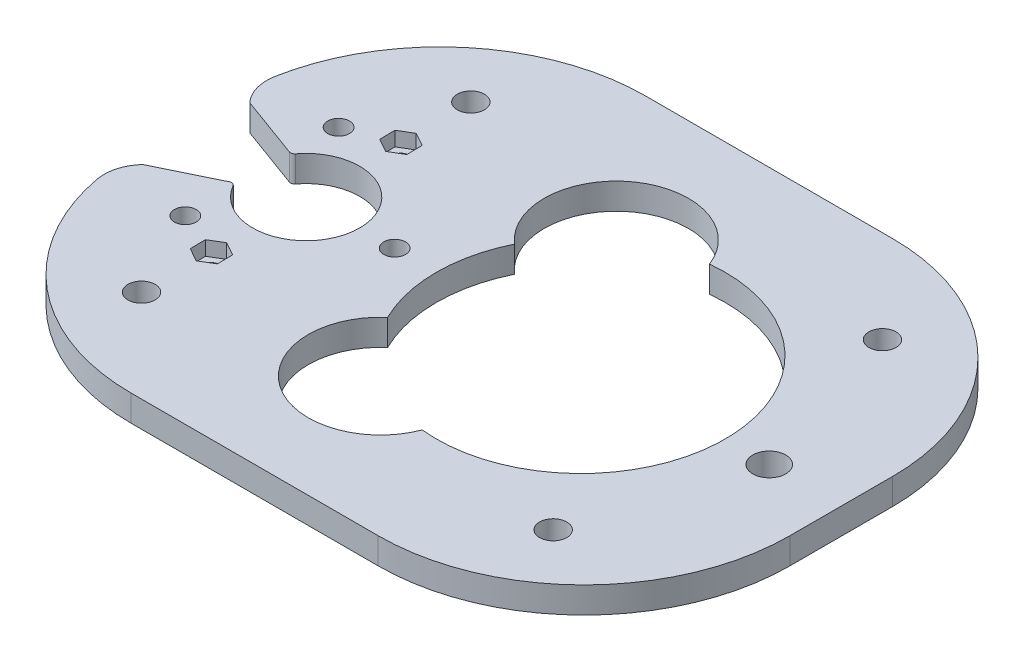
from build123d import *

# Parameters (mm, degrees)
SKETCH2_R                = 13
SKETCH2_R_2              = 4
BOSS_EXTRUDE1_DEPTH      = 6.35
FILLET1_R                = 50
M6_CLEARANCE_HOLE1_D     = 6.6
M6_CLEARANCE_HOLE1_DEPTH = 15
M6_CLEARANCE_HOLE1_TIP   = 1.982840043
FILLET2_R                = 10
CUT_EXTRUDE1_REACH       = 103.718
SKETCH5_R                = 2.65
SKETCH5_R_2              = 1.75
CUT_EXTRUDE2_DEPTH       = 3.5
CUT_EXTRUDE3_REACH       = 103.718
FILLET3_R                = 1
CUT_EXTRUDE4_REACH       = 103.718


with BuildPart() as part:
    # Sketch2 → Boss-Extrude1 (new body)
    with BuildSketch(Plane(origin=(0, 0, 0), x_dir=(1, 0, 0), z_dir=(0, 1, 0))):
        with BuildLine():
            ThreePointArc((-76.703745056, 13), (-79.7, 0), (-76.703745056, -13))
            Line((-76.703745056, -13), (-80, -13))
            Line((-80, -13), (-80, -62.5))
            Line((-80, -62.5), (80, -62.5))
            Line((80, -62.5), (80, 62.5))
            Line((80, 62.5), (-80, 62.5))
            Line((-80, 62.5), (-80, 13))
            Line((-80, 13), (-76.703745056, 13))
        make_face()
        with Locations(Location((-50, 0, 0), (0, 0, 270))):
            Circle(SKETCH2_R, mode=Mode.SUBTRACT)
        with Locations(Location((62.5, 0, 0), (0, 0, 270))):
            Circle(SKETCH2_R_2, mode=Mode.SUBTRACT)
    extrude(amount=BOSS_EXTRUDE1_DEPTH)

    # Fillet1
    # the kernel refuses this fillet: 50 mm, written as the material it takes off along each edge
    with BuildSketch(Plane(origin=(80, -125, 62.5), x_dir=(-1, 0, 0), z_dir=(0, 1, 0)), Plane(origin=(80, -125, -62.5), x_dir=(0, 0, 1), z_dir=(0, 1, 0))) as fillet1_piece_1:
        with BuildLine():
            CenterArc((FILLET1_R, -FILLET1_R), FILLET1_R, 90, 90)
            Line((0, -FILLET1_R), (-FILLET1_R * 0.02, -FILLET1_R))
            Line((-FILLET1_R * 0.02, -FILLET1_R), (-FILLET1_R * 0.02, FILLET1_R * 0.02))
            Line((-FILLET1_R * 0.02, FILLET1_R * 0.02), (FILLET1_R, FILLET1_R * 0.02))
            Line((FILLET1_R, FILLET1_R * 0.02), (FILLET1_R, 0))
        make_face()
    extrude(amount=256.35, mode=Mode.SUBTRACT)
    with BuildSketch(Plane(origin=(-80, -124.993749844, -62.5), x_dir=(1, 0, 0), z_dir=(0, 1, 0))) as fillet1_piece_2:
        with BuildLine():
            CenterArc((49.997499938, -50), FILLET1_R, 90, 89.427032655)
            Line((0, -49.5), (-0.999949999, -49.49))
            ThreePointArc((-0.999949999, -49.49), (-1, -24.75), (-1, 0))
            Line((-1, 0), (0, 1))
            Line((0, 1), (49.997499938, 1))
            Line((49.997499938, 1), (49.997499938, 0))
        make_face()
    extrude(amount=256.337499688, mode=Mode.SUBTRACT)
    with BuildSketch(Plane(origin=(-80, -124.993749844, 62.5), x_dir=(0, 0, -1), z_dir=(0, 1, 0))) as fillet1_piece_3:
        with BuildLine():
            CenterArc((50, -49.997499937), FILLET1_R, 90.572967345, 89.427032655)
            Line((0, -49.997499938), (-1, -49.997499938))
            Line((-1, -49.997499938), (-1, 0))
            Line((-1, 0), (0, 1))
            ThreePointArc((0, 1), (24.75, 1), (49.49, 0.999949999))
            Line((49.49, 0.999949999), (49.5, 0))
        make_face()
    extrude(amount=256.337499688, mode=Mode.SUBTRACT)

    # M6 Clearance Hole1
    with Locations(Plane(origin=(0, 6.35, 0), x_dir=(1, 0, 0), z_dir=(0, 1, 0))):
        with Locations((50, 40), (-50, -40), (-50, 40), (50, -40)):
            Hole(M6_CLEARANCE_HOLE1_D / 2, depth=M6_CLEARANCE_HOLE1_DEPTH)
            with Locations((0, 0, -(M6_CLEARANCE_HOLE1_DEPTH + M6_CLEARANCE_HOLE1_TIP / 2))):  # 118° drill point
                Cone(0, M6_CLEARANCE_HOLE1_D / 2, M6_CLEARANCE_HOLE1_TIP, mode=Mode.SUBTRACT)

    # Fillet2
    # the kernel refuses this fillet: 10 mm, written as the material it takes off along each edge
    with BuildSketch(Plane(origin=(-80, -21.546986926, 13), x_dir=(1, 0, 0), z_dir=(0, 1, 0))) as fillet2_piece_1:
        with BuildLine():
            CenterArc((10.662433046, -6.7630925), FILLET2_R, 137.444096304, 53.017550986)
            Line((0.828666324, -8.578865625), (0.631990989, -8.615181088))
            ThreePointArc((0.631990989, -8.615181088), (0.030066454, -4.326550643), (-0.19999, -0.002))
            Line((-0.19999, -0.002), (0, 0.2))
            ThreePointArc((0, 0.2), (1.648127472, 0.2), (3.148931382, 0.13526185))
            Line((3.148931382, 0.13526185), (3.296254944, 0))
        make_face()
    extrude(amount=49.443973852, mode=Mode.SUBTRACT)
    with BuildSketch(Plane(origin=(-80, -21.546986926, -13), x_dir=(1, 0, 0), z_dir=(0, 1, 0))) as fillet2_piece_2:
        with BuildLine():
            CenterArc((10.662433046, 6.7630925), FILLET2_R, 169.538352709, 53.017550986)
            Line((0.828666324, 8.578865625), (0.631990989, 8.615181088))
            ThreePointArc((0.631990989, 8.615181088), (0.030066454, 4.326550643), (-0.19999, 0.002))
            Line((-0.19999, 0.002), (0, -0.2))
            ThreePointArc((0, -0.2), (1.648127472, -0.2), (3.148931382, -0.13526185))
            Line((3.148931382, -0.13526185), (3.296254944, 0))
        make_face()
    extrude(amount=49.443973852, mode=Mode.SUBTRACT)

    # Sketch5 → Cut-Extrude1 (cut, up to next)
    with BuildSketch(Plane(origin=(0, 6.35, 0), x_dir=(1, 0, 0), z_dir=(0, 1, 0)), mode=Mode.PRIVATE) as cut_extrude1_sk1:
        with Locations(Location((-28.5, 0, 0), (0, 0, 270))):
            Circle(SKETCH5_R)
    cut_extrude1_tool1 = extrude(cut_extrude1_sk1.sketch, amount=-CUT_EXTRUDE1_REACH, mode=Mode.PRIVATE) & part.part
    # Sketch5 → Cut-Extrude1 (cut, up to next)
    with BuildSketch(Plane(origin=(0, 6.35, 0), x_dir=(1, 0, 0), z_dir=(0, 1, 0)), mode=Mode.PRIVATE) as cut_extrude1_sk2:
        with Locations(Location((-60.75, -18.619546181, 0), (0, 0, 270))):
            Circle(SKETCH5_R)
    cut_extrude1_tool2 = extrude(cut_extrude1_sk2.sketch, amount=-CUT_EXTRUDE1_REACH, mode=Mode.PRIVATE) & part.part
    # Sketch5 → Cut-Extrude1 (cut, up to next)
    with BuildSketch(Plane(origin=(0, 6.35, 0), x_dir=(1, 0, 0), z_dir=(0, 1, 0)), mode=Mode.PRIVATE) as cut_extrude1_sk3:
        with Locations(Location((-60.75, 18.619546181, 0), (0, 0, 270))):
            Circle(SKETCH5_R)
    cut_extrude1_tool3 = extrude(cut_extrude1_sk3.sketch, amount=-CUT_EXTRUDE1_REACH, mode=Mode.PRIVATE) & part.part
    # Sketch5 → Cut-Extrude1 (cut, up to next)
    with BuildSketch(Plane(origin=(0, 6.35, 0), x_dir=(1, 0, 0), z_dir=(0, 1, 0)), mode=Mode.PRIVATE) as cut_extrude1_sk4:
        with Locations(Location((-50, 23.015, 0), (0, 0, 270))):
            Circle(SKETCH5_R_2)
    cut_extrude1_tool4 = extrude(cut_extrude1_sk4.sketch, amount=-CUT_EXTRUDE1_REACH, mode=Mode.PRIVATE) & part.part
    # Sketch5 → Cut-Extrude1 (cut, up to next)
    with BuildSketch(Plane(origin=(0, 6.35, 0), x_dir=(1, 0, 0), z_dir=(0, 1, 0)), mode=Mode.PRIVATE) as cut_extrude1_sk5:
        with Locations(Location((-50, -23.015, 0), (0, 0, 270))):
            Circle(SKETCH5_R_2)
    cut_extrude1_tool5 = extrude(cut_extrude1_sk5.sketch, amount=-CUT_EXTRUDE1_REACH, mode=Mode.PRIVATE) & part.part
    add(cut_extrude1_tool1.solids().sort_by_distance((-28.5, 6.35, 0))[0], mode=Mode.SUBTRACT)
    add(cut_extrude1_tool2.solids().sort_by_distance((-60.75, 6.35, 18.619546))[0], mode=Mode.SUBTRACT)
    add(cut_extrude1_tool3.solids().sort_by_distance((-60.75, 6.35, -18.619546))[0], mode=Mode.SUBTRACT)
    add(cut_extrude1_tool4.solids().sort_by_distance((-50, 6.35, -23.015))[0], mode=Mode.SUBTRACT)
    add(cut_extrude1_tool5.solids().sort_by_distance((-50, 6.35, 23.015))[0], mode=Mode.SUBTRACT)

    # Sketch6 → Cut-Extrude2 (cut)
    with BuildSketch(Plane(origin=(0, 6.35, 0), x_dir=(1, 0, 0), z_dir=(0, 1, 0))):
        Polygon((-53.220697552, -24.941250403), (-49.942166993, -26.767331099), (-46.721469441, -24.841080696), (-46.779302448, -21.088749597), (-50.057833007, -19.262668901), (-53.278530559, -21.188919304), align=None)
        Polygon((-46.779302448, 24.941250403), (-50.057833007, 26.767331099), (-53.278530559, 24.841080696), (-53.220697552, 21.088749597), (-49.942166993, 19.262668901), (-46.721469441, 21.188919304), align=None)
    extrude(amount=-CUT_EXTRUDE2_DEPTH, mode=Mode.SUBTRACT)

    # Sketch7 → Cut-Extrude3 (cut, up to next)
    with BuildSketch(Plane(origin=(0, 6.35, 0), x_dir=(1, 0, 0), z_dir=(0, 1, 0)), mode=Mode.PRIVATE) as cut_extrude3_sk1:
        with BuildLine():
            Line((-76.703745056, 13), (-60.823662152, 7.200578978))
            ThreePointArc((-60.823662152, 7.200578978), (-62.970841385, 0.870214783), (-61.688507937, -5.69023569))
            Line((-61.688507937, -5.69023569), (-76.703745056, -13))
            ThreePointArc((-76.703745056, -13), (-79.7, 0), (-76.703745056, 13))
        make_face()
    cut_extrude3_tool1 = extrude(cut_extrude3_sk1.sketch, amount=-CUT_EXTRUDE3_REACH, mode=Mode.PRIVATE) & part.part
    add(cut_extrude3_tool1.solids().sort_by_distance((-71.4533, 6.35, -0.3701))[0], mode=Mode.SUBTRACT)

    # Fillet3
    fillet3_edges = [part.edges().sort_by_distance(p)[0] for p in [
        (-60.823662152, 3.175, -7.200578978),
        (-61.688507937, 3.175, 5.69023569),
    ]]
    fillet(fillet3_edges, radius=FILLET3_R)

    # Sketch8 → Cut-Extrude4 (cut, up to next)
    with BuildSketch(Plane(origin=(0, 6.35, 0), x_dir=(1, 0, 0), z_dir=(0, 1, 0)), mode=Mode.PRIVATE) as cut_extrude4_sk1:
        with BuildLine():
            ThreePointArc((13.086188506, -34.897759169), (51.803145873, 0), (13.086188506, 34.897759169))
            ThreePointArc((13.086188506, 34.897759169), (-13.347108623, 43.021646829), (-14.805555972, 15.406620499))
            ThreePointArc((-14.805555972, 15.406620499), (-18.369113715, 0), (-14.805555972, -15.406620499))
            ThreePointArc((-14.805555972, -15.406620499), (-13.347108623, -43.021646829), (13.086188506, -34.897759169))
        make_face()
    cut_extrude4_tool1 = extrude(cut_extrude4_sk1.sketch, amount=-CUT_EXTRUDE4_REACH, mode=Mode.PRIVATE) & part.part
    add(cut_extrude4_tool1.solids().sort_by_distance((11.588613, 6.35, 0))[0], mode=Mode.SUBTRACT)


solid = part.part
